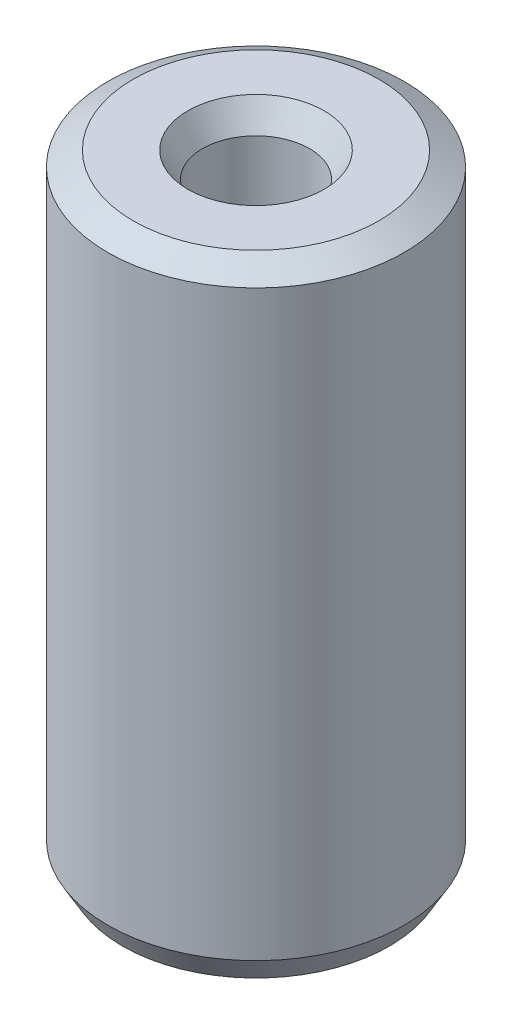
from build123d import *
from OCP.BRepFilletAPI import BRepFilletAPI_MakeChamfer

# Parameters (mm, degrees)
SKETCH1_R           = 12.5
BOSS_EXTRUDE1_DEPTH = 52.524237968
SKETCH2_R           = 4.508386955
CUT_EXTRUDE1_DEPTH  = 56.419270783
CHAMFER1_SIZE       = 1.238527945
CHAMFER1_SIZE2      = 2.145193327


with BuildPart() as part:
    # Sketch1 → Boss-Extrude1 (new body)
    with BuildSketch(Plane(origin=(0, 0, 0), x_dir=(1, 0, 0), z_dir=(0, 1, 0))):
        Circle(SKETCH1_R)
    extrude(amount=BOSS_EXTRUDE1_DEPTH)

    # Sketch2 → Cut-Extrude1 (cut, through all)
    with BuildSketch(Plane(origin=(0, 0, 0), x_dir=(1, 0, 0), z_dir=(0, 1, 0))):
        Circle(SKETCH2_R)
    extrude(amount=CUT_EXTRUDE1_DEPTH, mode=Mode.SUBTRACT)

    # Chamfer1: one chamfer whose edges measure the first distance from different faces: ONE call of the kernel's chamfer builder (chamfer() names one face for all edges)
    chamfer1_edges_1 = [part.edges().sort_by_distance(p)[0] for p in [
        (-4.508386955, 52.524237968, 0),
    ]]
    chamfer1_side_1 = [part.faces().sort_by_distance(p)[0] for p in [
        (-12.146446609, 52.524237968, 0),
    ]]
    chamfer1_edges_2 = [part.edges().sort_by_distance(p)[0] for p in [
        (-4.508386955, 0, 0),
    ]]
    chamfer1_side_2 = [part.faces().sort_by_distance(p)[0] for p in [
        (-4.508386955, 26.262118984, 0),
    ]]
    chamfer1_edges_3 = [part.edges().sort_by_distance(p)[0] for p in [
        (-12.5, 0, 0),
    ]]
    chamfer1_side_3 = [part.faces().sort_by_distance(p)[0] for p in [
        (-12.146446609, 0, 0),
    ]]
    chamfer1_edges_4 = [part.edges().sort_by_distance(p)[0] for p in [
        (-12.5, 52.524237968, 0),
    ]]
    chamfer1_side_4 = [part.faces().sort_by_distance(p)[0] for p in [
        (-12.5, 26.262118984, 0),
    ]]
    chamfer1 = BRepFilletAPI_MakeChamfer(part.part.solid().wrapped)
    for e in chamfer1_edges_1:
        chamfer1.Add(CHAMFER1_SIZE, CHAMFER1_SIZE2, e.wrapped, chamfer1_side_1[0].wrapped)  # the first distance lies on this face
    for e in chamfer1_edges_2:
        chamfer1.Add(CHAMFER1_SIZE, CHAMFER1_SIZE2, e.wrapped, chamfer1_side_2[0].wrapped)  # the first distance lies on this face
    for e in chamfer1_edges_3:
        chamfer1.Add(CHAMFER1_SIZE, CHAMFER1_SIZE2, e.wrapped, chamfer1_side_3[0].wrapped)  # the first distance lies on this face
    for e in chamfer1_edges_4:
        chamfer1.Add(CHAMFER1_SIZE, CHAMFER1_SIZE2, e.wrapped, chamfer1_side_4[0].wrapped)  # the first distance lies on this face
    add(Compound.cast(chamfer1.Shape()), mode=Mode.REPLACE)


solid = part.part
